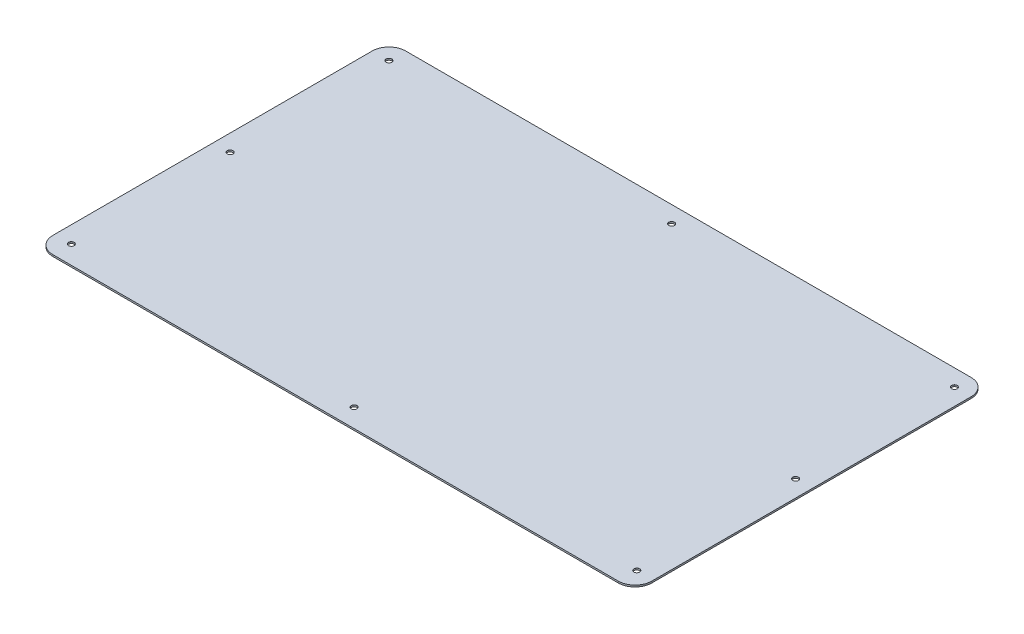
from build123d import *

# Parameters (mm, degrees)
SKETCH1_W                     = 358.27
SKETCH1_H                     = 211.05
BOSS_EXTRUDE1_DEPTH           = 1
FILLET1_R                     = 10
M3_CLEARANCE_HOLE1_AT_2_COUNT = 2
M3_CLEARANCE_HOLE1_AT_2_PITCH = 95
M3_CLEARANCE_HOLE1_AT_3_COUNT = 2
M3_CLEARANCE_HOLE1_AT_3_PITCH = 95
M3_CLEARANCE_HOLE1_AT_4_COUNT = 2
M3_CLEARANCE_HOLE1_AT_4_PITCH = 193.988783761
M3_CLEARANCE_HOLE1_AT_5_COUNT = 2
M3_CLEARANCE_HOLE1_AT_5_PITCH = 351.356788607
M3_CLEARANCE_HOLE1_AT_6_COUNT = 2
M3_CLEARANCE_HOLE1_AT_6_PITCH = 338.27
M3_CLEARANCE_HOLE1_AT_7_COUNT = 2
M3_CLEARANCE_HOLE1_AT_7_PITCH = 351.356788607
M3_CLEARANCE_HOLE1_AT_8_COUNT = 2
M3_CLEARANCE_HOLE1_AT_8_PITCH = 193.988783761


with BuildPart() as part:
    # Sketch1 → Boss-Extrude1 (new body)
    with BuildSketch(Plane(origin=(0, 0, 0), x_dir=(1, 0, 0), z_dir=(0, 1, 0))):
        Rectangle(SKETCH1_W, SKETCH1_H)
    extrude(amount=BOSS_EXTRUDE1_DEPTH)

    # Fillet1
    fillet1_edges = [part.edges().sort_by_distance(p)[0] for p in [
        (-179.135, 0.5, -105.525),
        (-179.135, 0.5, 105.525),
        (179.135, 0.5, -105.525),
        (179.135, 0.5, 105.525),
    ]]
    fillet(fillet1_edges, radius=FILLET1_R)

    # Sketch3 → M3 Clearance Hole1 (revolve, cut)
    with BuildSketch(Plane(origin=(169.135, 1, -0.525), x_dir=(0, 0, 1), z_dir=(1, 0, 0))):
        Polygon((0, 0), (0, 1), (1.7, 1), (1.7, 0.025), (1.725, 0), align=None)
    m3_clearance_hole1 = revolve(axis=Axis((169.135, 7.35, -0.525), (0, -1, 0)), mode=Mode.SUBTRACT)

    # M3 Clearance Hole1 at 2: M3 Clearance Hole1 ×2
    with Locations(*[(0, 0, i * M3_CLEARANCE_HOLE1_AT_2_PITCH) for i in range(1, M3_CLEARANCE_HOLE1_AT_2_COUNT)]):
        add(m3_clearance_hole1, mode=Mode.SUBTRACT)

    # M3 Clearance Hole1 at 3: M3 Clearance Hole1 ×2
    with Locations(*[(0, 0, -i * M3_CLEARANCE_HOLE1_AT_3_PITCH) for i in range(1, M3_CLEARANCE_HOLE1_AT_3_COUNT)]):
        add(m3_clearance_hole1, mode=Mode.SUBTRACT)

    # M3 Clearance Hole1 at 4: M3 Clearance Hole1 ×2
    with Locations(*[Vector(-0.871880305247654, 0, -0.48971903508160447) * (i * M3_CLEARANCE_HOLE1_AT_4_PITCH) for i in range(1, M3_CLEARANCE_HOLE1_AT_4_COUNT)]):
        add(m3_clearance_hole1, mode=Mode.SUBTRACT)

    # M3 Clearance Hole1 at 5: M3 Clearance Hole1 ×2
    with Locations(*[Vector(-0.9627535626717865, 0, -0.2703804311757465) * (i * M3_CLEARANCE_HOLE1_AT_5_PITCH) for i in range(1, M3_CLEARANCE_HOLE1_AT_5_COUNT)]):
        add(m3_clearance_hole1, mode=Mode.SUBTRACT)

    # M3 Clearance Hole1 at 6: M3 Clearance Hole1 ×2
    with Locations(*[(-i * M3_CLEARANCE_HOLE1_AT_6_PITCH, 0, 0) for i in range(1, M3_CLEARANCE_HOLE1_AT_6_COUNT)]):
        add(m3_clearance_hole1, mode=Mode.SUBTRACT)

    # M3 Clearance Hole1 at 7: M3 Clearance Hole1 ×2
    with Locations(*[Vector(-0.9627535626717866, 0, 0.27038043117574606) * (i * M3_CLEARANCE_HOLE1_AT_7_PITCH) for i in range(1, M3_CLEARANCE_HOLE1_AT_7_COUNT)]):
        add(m3_clearance_hole1, mode=Mode.SUBTRACT)

    # M3 Clearance Hole1 at 8: M3 Clearance Hole1 ×2
    with Locations(*[Vector(-0.8718803052476543, 0, 0.48971903508160397) * (i * M3_CLEARANCE_HOLE1_AT_8_PITCH) for i in range(1, M3_CLEARANCE_HOLE1_AT_8_COUNT)]):
        add(m3_clearance_hole1, mode=Mode.SUBTRACT)


solid = part.part
